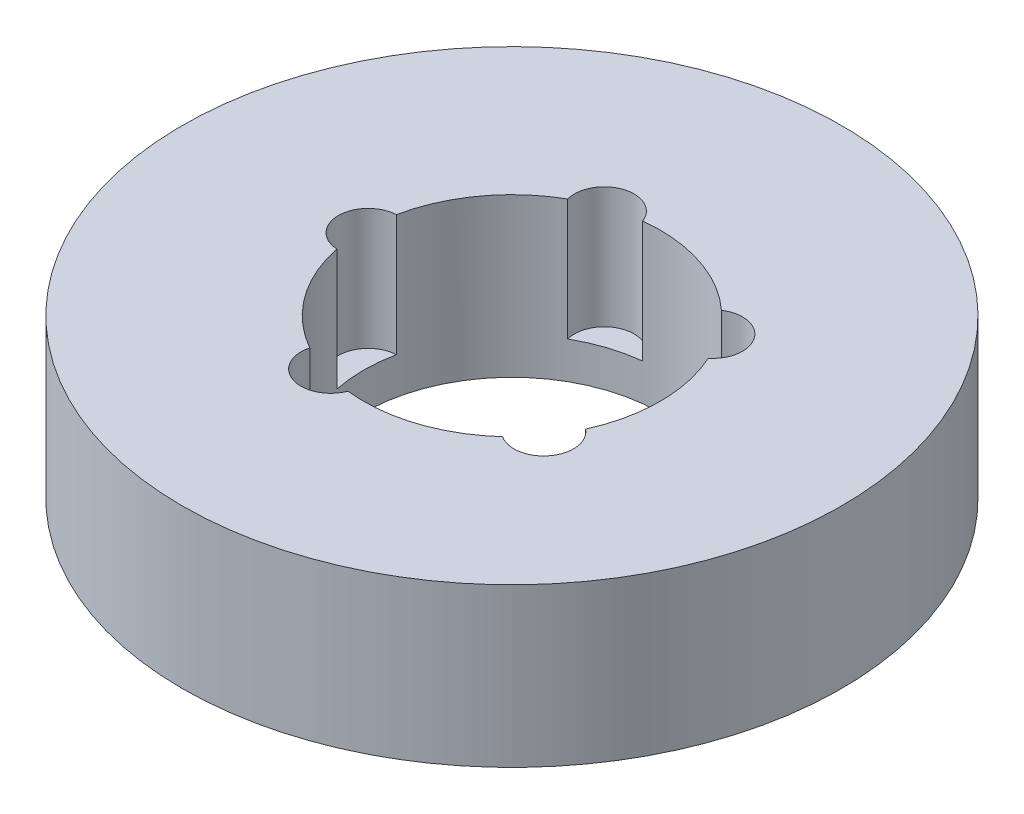
from build123d import *

# Parameters (mm, degrees)
SKETCH1_R           = 50
BOSS_EXTRUDE1_DEPTH = 24
SKETCH2_R           = 22.5
CUT_EXTRUDE1_DEPTH  = 75.67261881
SKETCH3_R           = 4.519573081
CUT_EXTRUDE2_DEPTH  = 18.395400767
CIRPATTERN1_COUNT   = 5


with BuildPart() as part:
    # Sketch1 → Boss-Extrude1 (new body)
    with BuildSketch(Plane(origin=(0, 0, 0), x_dir=(1, 0, 0), z_dir=(0, 1, 0))):
        Circle(SKETCH1_R)
    extrude(amount=BOSS_EXTRUDE1_DEPTH)

    # Sketch2 → Cut-Extrude1 (cut, through all)
    with BuildSketch(Plane(origin=(0, 0, 0), x_dir=(1, 0, 0), z_dir=(0, 1, 0))):
        Circle(SKETCH2_R)
    extrude(amount=CUT_EXTRUDE1_DEPTH, mode=Mode.SUBTRACT)

    # Sketch3 → Cut-Extrude2 (cut)
    with BuildSketch(Plane(origin=(0, 24, 0), x_dir=(1, 0, 0), z_dir=(0, 1, 0))):
        with Locations((-21.815769352, 0)):
            Circle(SKETCH3_R)
    cut_extrude2 = extrude(amount=-CUT_EXTRUDE2_DEPTH, mode=Mode.SUBTRACT)

    # CirPattern1: Cut-Extrude2 ×5 about axis
    cirpattern1_axis = Axis((0, 0, 0), (0, 1, 0))
    for i in range(1, CIRPATTERN1_COUNT):
        add(cut_extrude2.rotate(cirpattern1_axis, i * 360 / CIRPATTERN1_COUNT), mode=Mode.SUBTRACT)


solid = part.part
